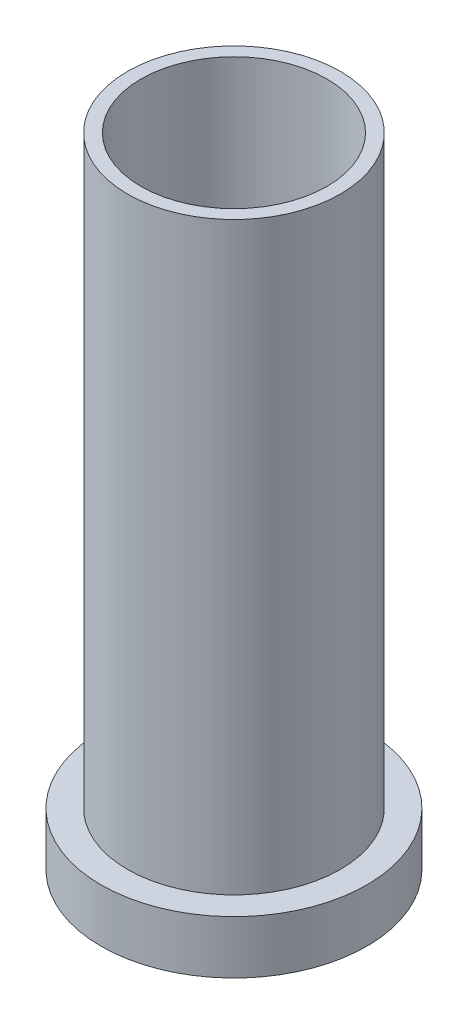
from build123d import *

# Parameters (mm, degrees)
SKETCH2_R           = 50.8
SKETCH2_R_2         = 44.45
BOSS_EXTRUDE1_DEPTH = 304.8
SKETCH4_R           = 63.5
SKETCH4_R_2         = 44.45
BOSS_EXTRUDE3_DEPTH = 25.4


with BuildPart() as part:
    # Sketch2 → Boss-Extrude1 (new body)
    with BuildSketch(Plane(origin=(0, 0, 0), x_dir=(1, 0, 0), z_dir=(0, 1, 0))):
        Circle(SKETCH2_R)
        Circle(SKETCH2_R_2, mode=Mode.SUBTRACT)
    extrude(amount=BOSS_EXTRUDE1_DEPTH)

    # Sketch4 → Boss-Extrude3 (add)
    with BuildSketch(Plane(origin=(0, 0, 0), x_dir=(1, 0, 0), z_dir=(0, 1, 0))):
        Circle(SKETCH4_R)
        Circle(SKETCH4_R_2, mode=Mode.SUBTRACT)
    extrude(amount=BOSS_EXTRUDE3_DEPTH)


solid = part.part
